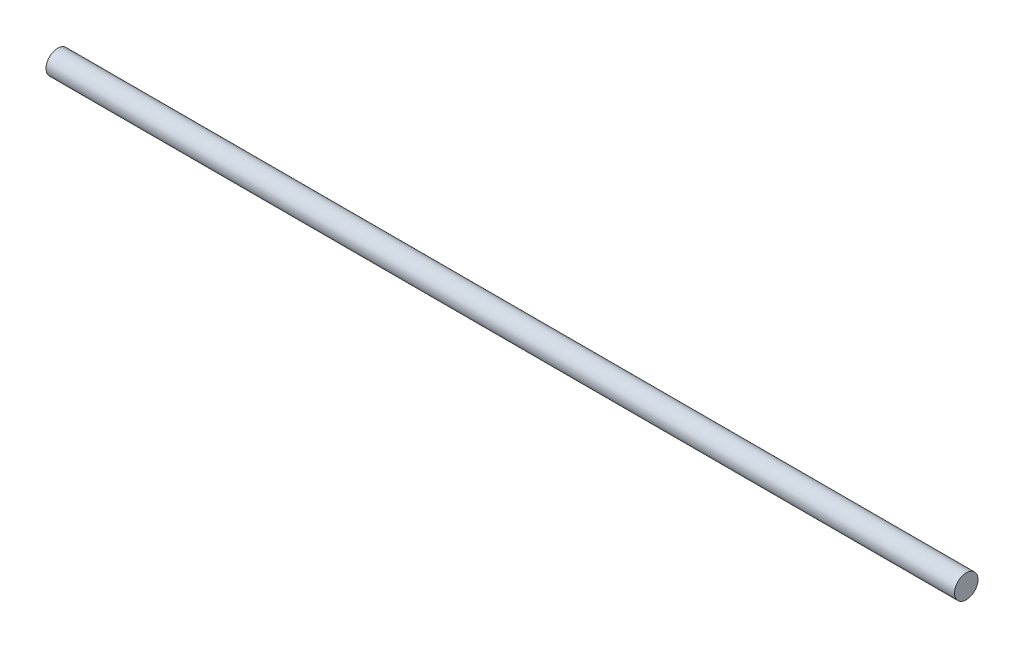
from build123d import *

# Parameters (mm, degrees)
CROQUIS1_R              = 4
SALIENTE_EXTRUIR1_DEPTH = 155


with BuildPart() as part:
    # Croquis1 → Saliente-Extruir1 (new, symmetric)
    with BuildSketch(Plane(origin=(0, 0, 0), x_dir=(0, 0, -1), z_dir=(1, 0, 0))):
        Circle(CROQUIS1_R)
    extrude(amount=SALIENTE_EXTRUIR1_DEPTH, both=True)


solid = part.part
